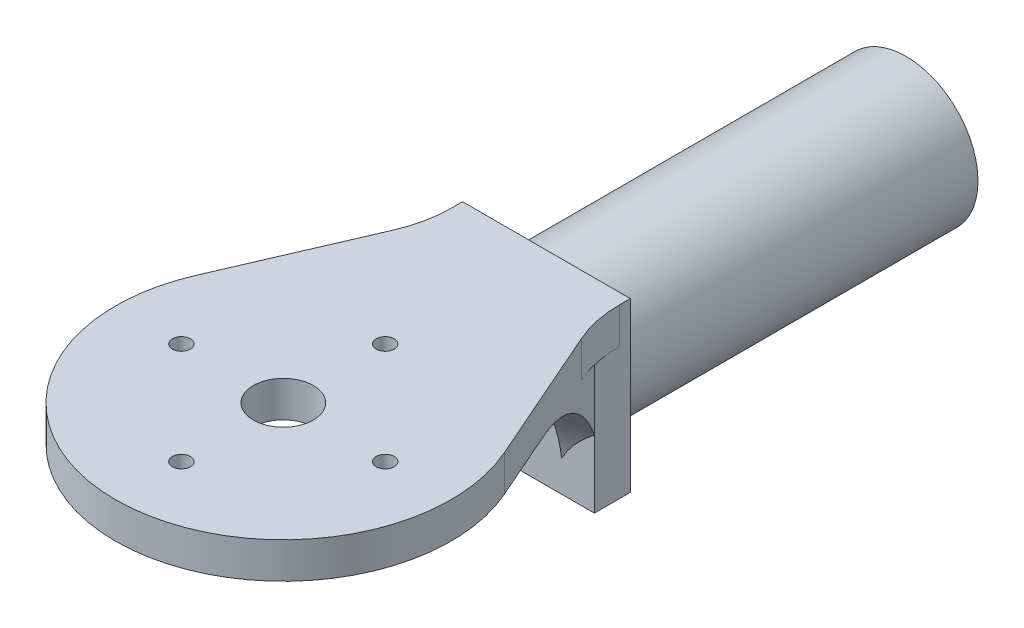
from build123d import *

# Parameters (mm, degrees)
SKETCH1_R                   = 6
ARM_INSERT_DEPTH            = 30
SKETCH2_W                   = 14
SKETCH2_H                   = 14
FACE_PLATE_DEPTH            = 3
SKETCH3_R                   = 0.75
SKETCH3_R_2                 = 2.5
MOTOR_MOUNT_DEPTH           = 3
MOTOR_MOUNT_SUPPORT_1_DEPTH = 2.5
MOTOR_MOUNT_SUPPORT_2_DEPTH = 2.5
SKETCH8_R                   = 2.5
LIGHTENING_HOLE_DEPTH       = 68.841325022


with BuildPart() as part:
    # Sketch1 → Arm Insert (new body)
    with BuildSketch(Plane.XY):
        Circle(SKETCH1_R)
    extrude(amount=ARM_INSERT_DEPTH)

    # Sketch2 → Face Plate (add)
    with BuildSketch(Plane.XY.offset(30)):
        Rectangle(SKETCH2_W, SKETCH2_H)
    extrude(amount=FACE_PLATE_DEPTH)

    # Sketch3 → Motor Mount (add)
    with BuildSketch(Plane(origin=(0, 7, 0), x_dir=(1, 0, 0), z_dir=(0, 1, 0))):
        with BuildLine():
            ThreePointArc((-7, -30.935385736), (-7.206551185, -32.957355148), (-7.817672061, -34.895796524))
            Line((-7.817672061, -34.895796524), (-12.803400836, -46.455354126))
            ThreePointArc((-12.803400836, -46.455354126), (0.09736558, -65.999855268), (12.870800409, -46.371899141))
            Line((12.870800409, -46.371899141), (7.843612764, -34.921493496))
            ThreePointArc((7.843612764, -34.921493496), (7.213175378, -32.95526455), (7, -30.901472004))
            Line((7, -30.901472004), (7, -33))
            Line((7, -33), (-7, -33))
            Line((-7, -33), (-7, -30.935385736))
        make_face()
        with Locations((0.051858279, -43.499929229)):
            Circle(SKETCH3_R, mode=Mode.SUBTRACT)
        with Locations((-8.448141721, -51.999929229)):
            Circle(SKETCH3_R, mode=Mode.SUBTRACT)
        with Locations((0.051858279, -60.499929229)):
            Circle(SKETCH3_R, mode=Mode.SUBTRACT)
        with Locations((0.051858279, -51.999929229)):
            Circle(SKETCH3_R_2, mode=Mode.SUBTRACT)
        with Locations((8.551858279, -51.999929229)):
            Circle(SKETCH3_R, mode=Mode.SUBTRACT)
    extrude(amount=-MOTOR_MOUNT_DEPTH)

    # Sketch4 → Motor Mount Support 1 (add)
    with BuildSketch(Plane(origin=(6.098650662, 0, 2.630396348), x_dir=(-0.39604107883214285, 0, 0.9182327939457796), z_dir=(-0.9182327939457796, 0, -0.39604107883214285))):
        with BuildLine():
            Line((31.696620561, -7), (31.696620561, 4))
            Line((31.696620561, 4), (41.433043154, 4))
            add(Edge.make_bspline(
                [(41.433043154, 4), (31.696620561, 4), (31.696620561, -7)],
                knots=[3.141592654, 3.141592654, 3.141592654, 4.71238898, 4.71238898, 4.71238898], degree=2, weights=[1, 0.707106781, 1]))
        make_face()
    extrude(amount=-MOTOR_MOUNT_SUPPORT_1_DEPTH)

    # Sketch5 → Motor Mount Support 2 (add)
    with BuildSketch(Plane(origin=(-6.278168341, 0, 2.756367878), x_dir=(-0.402002149140903, 0, -0.9156387235619163), z_dir=(0.9156387235619163, 0, -0.402002149140903))):
        with BuildLine():
            Line((-31.656634836, -7), (-31.656634836, 4))
            Line((-31.656634836, 4), (-41.381308441, 4))
            add(Edge.make_bspline(
                [(-31.656634836, -7), (-31.656634836, 4), (-41.381308441, 4)],
                knots=[1.570796327, 1.570796327, 1.570796327, 3.141592654, 3.141592654, 3.141592654], degree=2, weights=[1, 0.707106781, 1]))
        make_face()
    extrude(amount=-MOTOR_MOUNT_SUPPORT_2_DEPTH)

    # Sketch8 → Lightening Hole (cut, through all)
    with BuildSketch(Plane(origin=(0, 0, 0), x_dir=(-1, 0, 0), z_dir=(0, 0, -1))):
        Circle(SKETCH8_R)
    extrude(amount=-LIGHTENING_HOLE_DEPTH, mode=Mode.SUBTRACT)


solid = part.part
